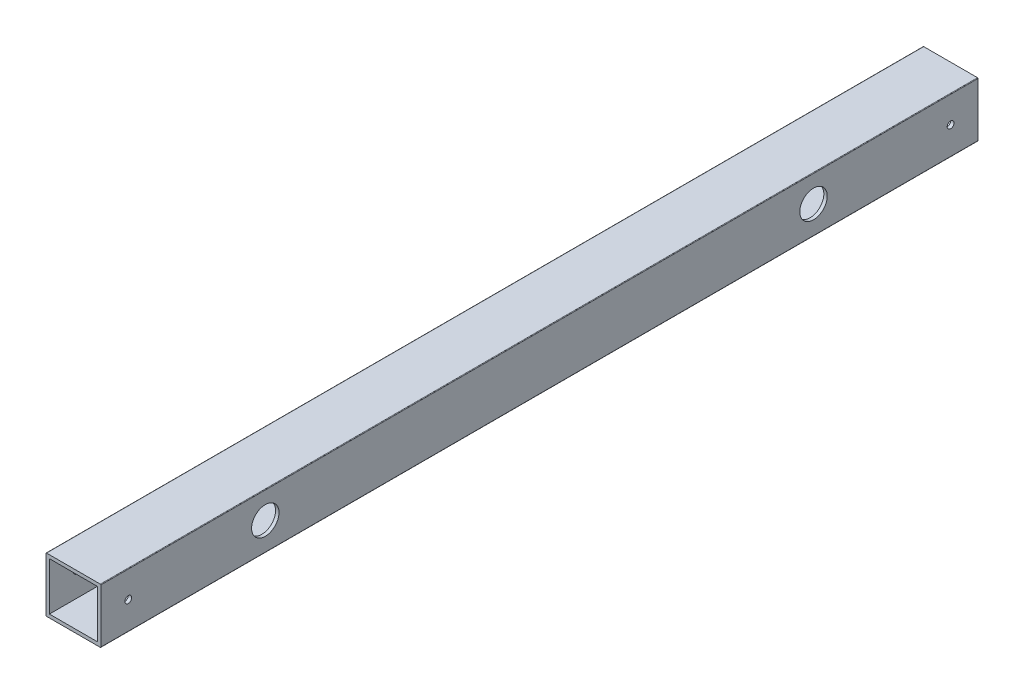
from build123d import *

# Parameters (mm, degrees)
SKETCH1_W           = 22.225
SKETCH1_H           = 22.225
BOSS_EXTRUDE1_DEPTH = 406.4
SKETCH2_R           = 1.5875
SKETCH2_R_2         = 6.35
CUT_EXTRUDE1_DEPTH  = 408.888655341


with BuildPart() as part:
    # Sketch1 → Boss-Extrude1 (new body)
    with BuildSketch(Plane(origin=(0, 0, 0), x_dir=(-1, 0, 0), z_dir=(0, 0, -1))):
        with BuildLine():
            Line((1.5875, -1.3335), (1.5875, 23.5585))
            ThreePointArc((1.5875, 23.5585), (1.513105122, 23.738105122), (1.3335, 23.8125))
            Line((1.3335, 23.8125), (-23.5585, 23.8125))
            ThreePointArc((-23.5585, 23.8125), (-23.738105122, 23.738105122), (-23.8125, 23.5585))
            Line((-23.8125, 23.5585), (-23.8125, -1.3335))
            ThreePointArc((-23.8125, -1.3335), (-23.738105122, -1.513105122), (-23.5585, -1.5875))
            Line((-23.5585, -1.5875), (1.3335, -1.5875))
            ThreePointArc((1.3335, -1.5875), (1.513105122, -1.513105122), (1.5875, -1.3335))
        make_face()
        with Locations((-11.1125, 11.1125)):
            Rectangle(SKETCH1_W, SKETCH1_H, mode=Mode.SUBTRACT)
    extrude(amount=-BOSS_EXTRUDE1_DEPTH)

    # Sketch2 → Cut-Extrude1 (cut, through all)
    with BuildSketch(Plane.ZY.offset(1.5875)):
        with Locations((12.697459746, 11.3665)):
            Circle(SKETCH2_R)
        with Locations((393.7, 11.3665)):
            Circle(SKETCH2_R)
        with Locations((76.2, 11.3665)):
            Circle(SKETCH2_R_2)
        with Locations((330.2, 11.3665)):
            Circle(SKETCH2_R_2)
    extrude(amount=-CUT_EXTRUDE1_DEPTH, mode=Mode.SUBTRACT)


solid = part.part
